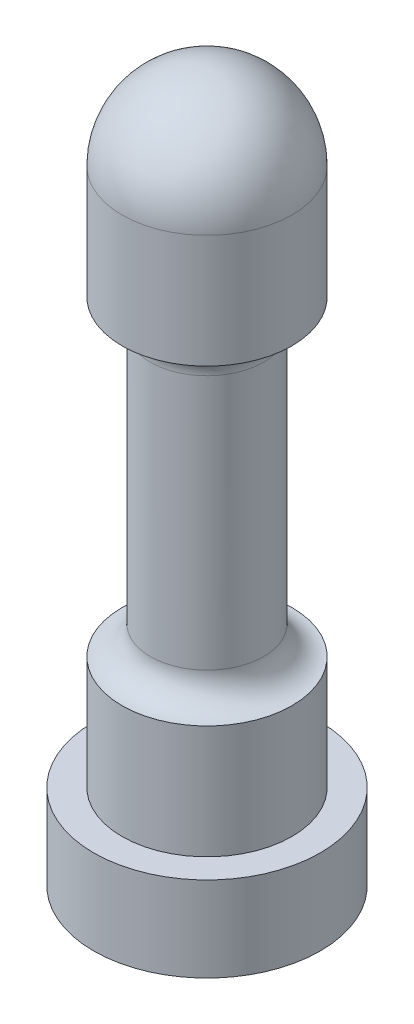
from build123d import *

# Parameters (mm, degrees)
FILLET1_R = 3
FILLET2_R = 1


with BuildPart() as part:
    # Sketch1 → Revolve1 (revolve)
    with BuildSketch(Plane.XY, mode=Mode.PRIVATE) as revolve1_sk:
        Polygon((0, 0), (0, 25), (3, 25), (3, 18), (2, 18), (2, 7), (3, 7), (3, 3), (4, 3), (4, 0), align=None)
    revolve(revolve1_sk.sketch.rotate(Axis((0, 0, 0), (0, 1, 0)), 90), axis=Axis((0, 0, 0), (0, 1, 0)))

    # Fillet1
    fillet1_edges = [part.edges().sort_by_distance(p)[0] for p in [
        (0, 25, 3),
    ]]
    fillet(fillet1_edges, radius=FILLET1_R)

    # Fillet2
    fillet2_edges = [part.edges().sort_by_distance(p)[0] for p in [
        (0, 18, 2),
        (0, 7, 2),
    ]]
    fillet(fillet2_edges, radius=FILLET2_R - 0.0001)  # a hair under: the kernel refuses the full size

    # Sketch2 → Cut-Revolve1 (revolve, cut)
    with BuildSketch(Plane.XY, mode=Mode.PRIVATE) as cut_revolve1_sk:
        with BuildLine():
            Line((0, 2.825522326), (0, 0))
            Line((0, 0), (2.825522326, 0))
            ThreePointArc((2.825522326, 0), (1.997945997, 1.997945997), (0, 2.825522326))
        make_face()
    revolve(cut_revolve1_sk.sketch.rotate(Axis((0, 2.825522326, 0), (0, -1, 0)), 270), axis=Axis((0, 2.825522326, 0), (0, -1, 0)), mode=Mode.SUBTRACT)


solid = part.part
